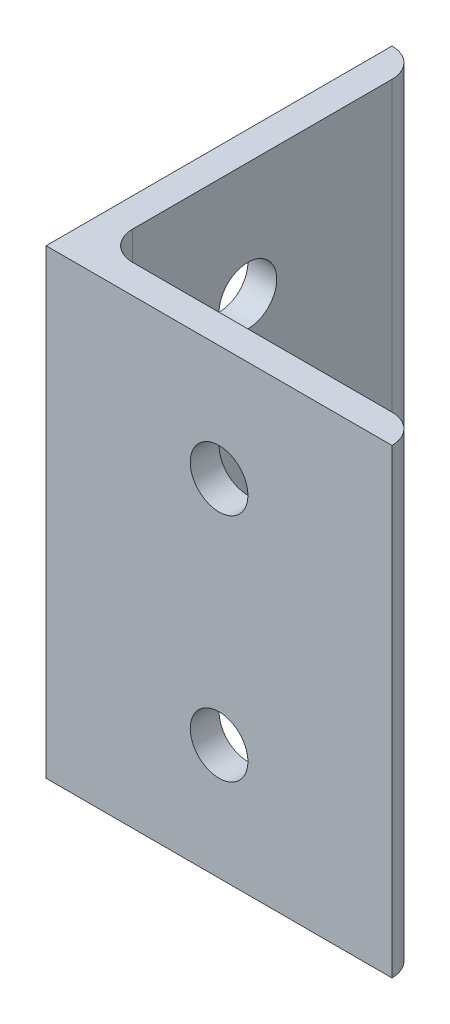
from build123d import *

# Parameters (mm, degrees)
EXTRUDE_THIN1_DEPTH = 25.4
FILLET1_R           = 3.175
SKETCH2_R           = 3.175
CUT_EXTRUDE1_DEPTH  = 58.589283942
SKETCH3_R           = 3.175
CUT_EXTRUDE2_DEPTH  = 60.56828015


with BuildPart() as part:
    # Sketch1 → Extrude-Thin1 (new, symmetric)
    with BuildSketch(Plane(origin=(0, 0, 0), x_dir=(1, 0, 0), z_dir=(0, 1, 0))):
        Polygon((0, 38.1), (0, 0), (38.1, 0), (38.1, 3.175), (3.175, 3.175), (3.175, 38.1), align=None)
    extrude(amount=EXTRUDE_THIN1_DEPTH, both=True)

    # Fillet1
    fillet1_edges = [part.edges().sort_by_distance(p)[0] for p in [
        (3.175, 0, -3.175),
        (38.1, 0, -3.175),
        (3.175, 0, -38.1),
    ]]
    fillet(fillet1_edges, radius=FILLET1_R - 0.0001)  # a hair under: the kernel refuses the full size

    # Sketch2 → Cut-Extrude1 (cut, through all)
    with BuildSketch(Plane(origin=(0, 0, -3.175), x_dir=(-1, 0, 0), z_dir=(0, 0, -1))):
        with Locations((-19.05, 12.7)):
            Circle(SKETCH2_R)
        with Locations((-19.05, -12.7)):
            Circle(SKETCH2_R)
    extrude(amount=-CUT_EXTRUDE1_DEPTH, mode=Mode.SUBTRACT)

    # Sketch3 → Cut-Extrude2 (cut, through all)
    with BuildSketch(Plane.ZY):
        with Locations((-19.05, 12.7)):
            Circle(SKETCH3_R)
        with Locations((-19.05, -12.7)):
            Circle(SKETCH3_R)
    extrude(amount=-CUT_EXTRUDE2_DEPTH, mode=Mode.SUBTRACT)


solid = part.part
